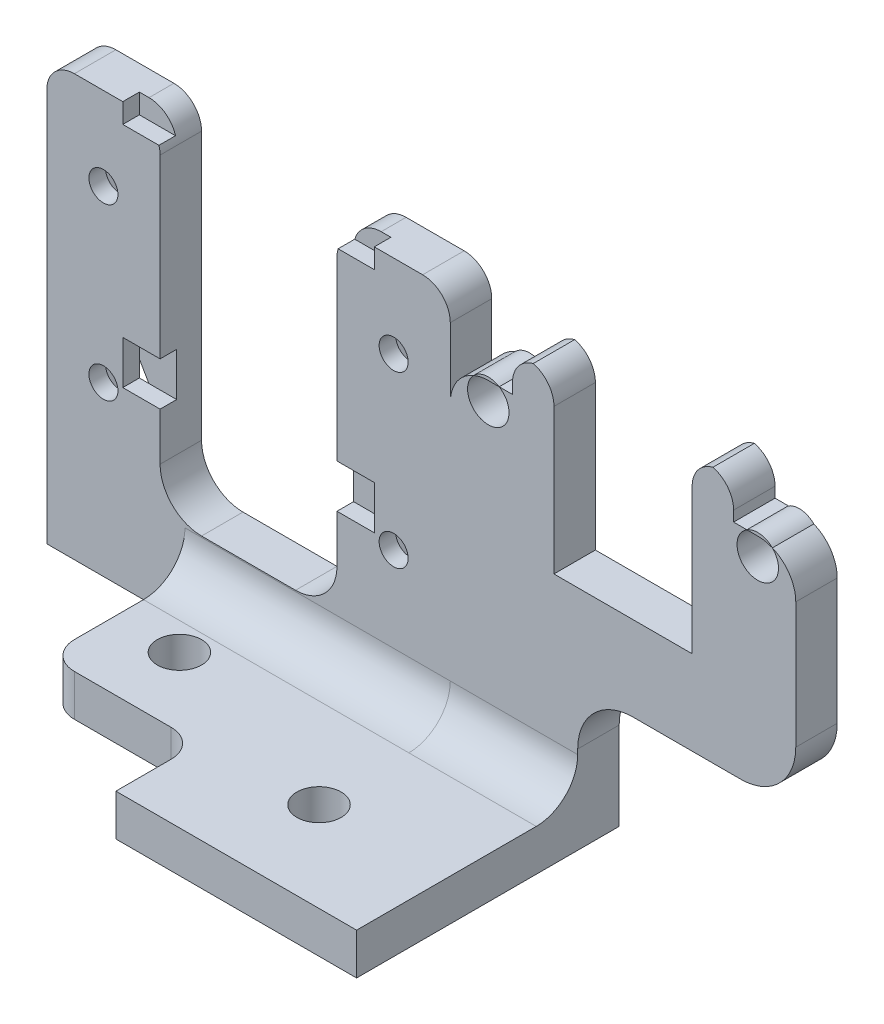
from build123d import *

# Parameters (mm, degrees)
ESBO_O2_W                  = 8.2
ESBO_O2_H                  = 30.460387467
RESSALTO_EXTRUS_O1_DEPTH   = 3
RESSALTO_EXTRUS_O1_2_DEPTH = 3
RESSALTO_EXTRUS_O2_REACH   = 32.935
ESBO_O3_W                  = 3
ESBO_O3_H                  = 6.088150409
ESBO_O4_W                  = 12.8
ESBO_O4_H                  = 3
RESSALTO_EXTRUS_O3_DEPTH   = 10
ESBO_O5_W                  = 8.2
ESBO_O5_H                  = 3
RESSALTO_EXTRUS_O4_DEPTH   = 16
ESBO_O8_R                  = 1.05
CORTE_EXTRUS_O3_DEPTH      = 32.131124741
FILETE1_R                  = 3
ESBO_O9_W                  = 1.2
ESBO_O9_H                  = 3.148787123
CORTE_EXTRUS_O4_DEPTH      = 2.7
FILETE2_R                  = 3
CORTE_EXTRUS_O5_DEPTH      = 1.8
ESBO_O13_W                 = 2.7
ESBO_O13_H                 = 3.148787123
CORTE_EXTRUS_O7_DEPTH      = 1.2
ESBO_O14_W                 = 19
ESBO_O14_H                 = 3
RESSALTO_EXTRUS_O5_DEPTH   = 25
ESBO_O15_W                 = 25
ESBO_O15_H                 = 3
RESSALTO_EXTRUS_O6_DEPTH   = 25.96
ESBO_O16_W                 = 10
ESBO_O16_H                 = 12.5
ESBO_O16_W_2               = 15.78
ESBO_O16_H_2               = 7.353285402
CORTE_EXTRUS_O8_DEPTH      = 26
FILETE4_R                  = 4
FILETE5_R                  = 2
CORTE_EXTRUS_O10_DEPTH     = 10
ESBO_O19_W                 = 19
ESBO_O19_H                 = 5
CORTE_EXTRUS_O13_DEPTH     = 15.78
FILETE7_R                  = 4
FILETE8_R                  = 3
ESBO_O20_R                 = 1.6
CORTE_EXTRUS_O14_DEPTH     = 12
FILETE9_R                  = 2


with BuildPart() as part:
    # Esboço2 → Ressalto-extrusão1 (new body)
    with BuildSketch(Plane(origin=(0, 0, -1), x_dir=(-1, 0, 0), z_dir=(0, 0, -1))):
        with Locations((10.5, -7.130193734)):
            Rectangle(ESBO_O2_W, ESBO_O2_H)
    extrude(amount=RESSALTO_EXTRUS_O1_DEPTH)


with BuildPart() as body_2:
    # Esboço2 → Ressalto-extrus_o1 2 (new body)
    with BuildSketch(Plane(origin=(0, 0, -1), x_dir=(-1, 0, 0), z_dir=(0, 0, -1))):
        with Locations((-10.5, -7.130193734)):
            Rectangle(ESBO_O2_W, ESBO_O2_H)
    extrude(amount=RESSALTO_EXTRUS_O1_2_DEPTH)

    # Esboço3 → Ressalto-extrusão2 (add, up to next)
    with BuildSketch(Plane(origin=(-6.4, 0, 0), x_dir=(0, 0, -1), z_dir=(1, 0, 0)), mode=Mode.PRIVATE) as ressalto_extrus_o2_sk1:
        with Locations((2.5, -19.316312263)):
            Rectangle(ESBO_O3_W, ESBO_O3_H)
    ressalto_extrus_o2_tool1 = extrude(ressalto_extrus_o2_sk1.sketch, amount=RESSALTO_EXTRUS_O2_REACH, mode=Mode.PRIVATE) - body_2.part

    add(part.part)  # Ressalto-extrusão2 merges part
    add(ressalto_extrus_o2_tool1.solids().sort_by_distance((-6.4, -19.316312, -2.5))[0])

    # Esboço4 → Ressalto-extrusão3 (add)
    with BuildSketch(Plane.XY.offset(-1)):
        with Locations((0, -20.860387467)):
            Rectangle(ESBO_O4_W, ESBO_O4_H)
    extrude(amount=RESSALTO_EXTRUS_O3_DEPTH)

    # Esboço5 → Ressalto-extrusão4 (add)
    with BuildSketch(Plane.XY.offset(-1)):
        with Locations((-10.5, -20.860387467)):
            Rectangle(ESBO_O5_W, ESBO_O5_H)
        with Locations((10.5, -20.860387467)):
            Rectangle(ESBO_O5_W, ESBO_O5_H)
    extrude(amount=RESSALTO_EXTRUS_O4_DEPTH)

    # Esboço8 → Corte-extrusão3 (cut, through all)
    with BuildSketch(Plane.XY.offset(-1)):
        with Locations((-10.5, 2.1)):
            Circle(ESBO_O8_R)
        with Locations((10.5, 2.1)):
            Circle(ESBO_O8_R)
        with Locations((10.5, -10.2)):
            Circle(ESBO_O8_R)
        with Locations((-10.5, -10.2)):
            Circle(ESBO_O8_R)
    extrude(amount=-CORTE_EXTRUS_O3_DEPTH, mode=Mode.SUBTRACT)

    # Filete1
    filete1_edges = [body_2.edges().sort_by_distance(p)[0] for p in [
        (6.4, -16.272237058, -2.5),
        (-6.4, -16.272237058, -2.5),
    ]]
    fillet(filete1_edges, radius=FILETE1_R)

    # Esboço9 → Corte-extrusão4 (cut)
    with BuildSketch(Plane.ZY.offset(-6.4)):
        with Locations((-1.6, -8.245598841)):
            Rectangle(ESBO_O9_W, ESBO_O9_H)
    extrude(amount=-CORTE_EXTRUS_O4_DEPTH, mode=Mode.SUBTRACT)

    # Filete2
    filete2_edges = [body_2.edges().sort_by_distance(p)[0] for p in [
        (0, -19.360387467, -1),
    ]]
    fillet(filete2_edges, radius=FILETE2_R)

    # Esboço10 → Corte-extrusão5 (cut)
    with BuildSketch(Plane(origin=(0, 0, -4), x_dir=(-1, 0, 0), z_dir=(0, 0, -1))):
        Polygon((12.809401077, 2.1), (11.654700538, 4.1), (9.345299462, 4.1), (8.190598923, 2.1), (9.345299462, 0.1), (11.654700538, 0.1), align=None)
        Polygon((12.809401077, -10.2), (11.654700538, -8.2), (9.345299462, -8.2), (8.190598923, -10.2), (9.345299462, -12.2), (11.654700538, -12.2), align=None)
        Polygon((-11.654700538, -12.2), (-12.809401077, -10.2), (-11.654700538, -8.2), (-9.345299462, -8.2), (-8.190598923, -10.2), (-9.345299462, -12.2), align=None)
        Polygon((-11.654700538, 0.1), (-12.809401077, 2.1), (-11.654700538, 4.1), (-9.345299462, 4.1), (-8.190598923, 2.1), (-9.345299462, 0.1), align=None)
    extrude(amount=-CORTE_EXTRUS_O5_DEPTH, mode=Mode.SUBTRACT)

    # Esboço13 → Corte-extrusão7 (cut)
    with BuildSketch(Plane.XY.offset(-1)):
        with Locations((7.75, -8.245598841)):
            Rectangle(ESBO_O13_W, ESBO_O13_H)
        with Locations((7.75, 8.245598841)):
            Rectangle(ESBO_O13_W, ESBO_O13_H)
        with Locations((-7.75, 8.245598841)):
            Rectangle(ESBO_O13_W, ESBO_O13_H)
        with Locations((-7.75, -8.245598841)):
            Rectangle(ESBO_O13_W, ESBO_O13_H)
    extrude(amount=-CORTE_EXTRUS_O7_DEPTH, mode=Mode.SUBTRACT)

    # Esboço14 → Ressalto-extrusão5 (add)
    with BuildSketch(Plane(origin=(14.6, 0, 0), x_dir=(0, 0, -1), z_dir=(1, 0, 0))):
        with Locations((-5.5, -20.860387467)):
            Rectangle(ESBO_O14_W, ESBO_O14_H)
    extrude(amount=RESSALTO_EXTRUS_O5_DEPTH)

    # Esboço15 → Ressalto-extrusão6 (add)
    with BuildSketch(Plane(origin=(0, -19.360387467, 0), x_dir=(1, 0, 0), z_dir=(0, 1, 0))):
        with Locations((27.1, 2.5)):
            Rectangle(ESBO_O15_W, ESBO_O15_H)
    extrude(amount=RESSALTO_EXTRUS_O6_DEPTH)

    # Esboço16 → Corte-extrusão8 (cut)
    with BuildSketch(Plane(origin=(0, 0, -4), x_dir=(-1, 0, 0), z_dir=(0, 0, -1))):
        with BuildLine():
            Line((-36.06071018, 3.849612533), (-35.1, 3.849612533))
            Line((-35.1, 3.849612533), (-35.1, 6.599612533))
            Line((-35.1, 6.599612533), (-39.6, 6.599612533))
            Line((-39.6, 6.599612533), (-39.6, 1.099612533))
            ThreePointArc((-39.6, 1.099612533), (-39.137935656, 2.625342009), (-37.907017867, 3.638354983))
            ThreePointArc((-37.907017867, 3.638354983), (-37.020519838, 4.064341116), (-36.06071018, 3.849612533))
        make_face()
        with BuildLine():
            ThreePointArc((-37.907017867, 3.638354983), (-36.679480162, 1.083788828), (-36.06071018, 3.849612533))
            Line((-36.06071018, 3.849612533), (-36.85, 3.849612533))
            ThreePointArc((-36.85, 3.849612533), (-37.388961159, 3.796281009), (-37.907017867, 3.638354983))
        make_face()
        with Locations((-27.1, 0.349612533)):
            Rectangle(ESBO_O16_W, ESBO_O16_H)
        with Locations((-31.71, -15.683744766)):
            Rectangle(ESBO_O16_W_2, ESBO_O16_H_2)
        with BuildLine():
            Line((-14.6, 6.599612533), (-19.1, 6.599612533))
            Line((-19.1, 6.599612533), (-19.1, 3.849612533))
            Line((-19.1, 3.849612533), (-18.13928982, 3.849612533))
            ThreePointArc((-18.13928982, 3.849612533), (-17.179480162, 4.064341116), (-16.292982133, 3.638354983))
            ThreePointArc((-16.292982133, 3.638354983), (-15.062064344, 2.625342009), (-14.6, 1.099612533))
            Line((-14.6, 1.099612533), (-14.6, 6.599612533))
        make_face()
        with BuildLine():
            Line((-17.35, 3.849612533), (-18.13928982, 3.849612533))
            ThreePointArc((-18.13928982, 3.849612533), (-17.520519838, 1.083788828), (-16.292982133, 3.638354983))
            ThreePointArc((-16.292982133, 3.638354983), (-16.811038841, 3.796281009), (-17.35, 3.849612533))
        make_face()
    extrude(amount=-CORTE_EXTRUS_O8_DEPTH, mode=Mode.SUBTRACT)


with BuildPart() as corte_extrus_o8_piece_1:
    # of the separate pieces the step leaves, piece 1, a body of its own (corte_extrus_o8_pieces)
    add(body_2.part.solids().sort_by_distance((14.6, -19.360387467, -1))[0])

    # Filete4
    filete4_edges = [corte_extrus_o8_piece_1.edges().sort_by_distance(p)[0] for p in [
        (39.6, -12.007102065, -2.5),
    ]]
    fillet(filete4_edges, radius=FILETE4_R)

    # Filete5
    # the kernel refuses this fillet: 2 mm, written as the material it takes off along each edge
    with BuildSketch(Plane(origin=(32.1, 6.599612533, -9), x_dir=(1, 0, 0), z_dir=(0, 0, 1)), Plane(origin=(19.1, 6.599612533, -9), x_dir=(1, 0, 0), z_dir=(0, 0, 1)), Plane(origin=(35.1, 6.599612533, -9), x_dir=(0, -1, 0), z_dir=(0, 0, 1)), Plane(origin=(22.1, 6.599612533, -9), x_dir=(0, -1, 0), z_dir=(0, 0, 1)), Plane(origin=(14.6, 8.1, 4), x_dir=(-1, 0, 0), z_dir=(0, 0, -1)), Plane(origin=(-14.6, 8.1, 4), x_dir=(0, -1, 0), z_dir=(0, 0, -1))) as filete5_piece_1:
        with BuildLine():
            CenterArc((FILETE5_R, -FILETE5_R), FILETE5_R, 90, 90)
            Line((0, -FILETE5_R), (0, 0))
            Line((0, 0), (FILETE5_R, 0))
        make_face()
    extrude(amount=13, mode=Mode.SUBTRACT)
    with BuildSketch(Plane(origin=(-6.4, 8.1, 2.8), x_dir=(-1, 0, 0), z_dir=(0, 0, -1)), Plane(origin=(6.4, 8.1, 2.8), x_dir=(0, -1, 0), z_dir=(0, 0, -1))) as filete5_piece_2:
        with BuildLine():
            CenterArc((FILETE5_R, -FILETE5_R), FILETE5_R, 90, 90)
            Line((0, -FILETE5_R), (0, 0))
            Line((0, 0), (FILETE5_R, 0))
        make_face()
    extrude(amount=11.8, mode=Mode.SUBTRACT)

    # Esboço18 → Corte-extrusão10 (cut)
    with BuildSketch(Plane.ZY.offset(14.6)):
        Polygon((-1, -16.360387467), (-1, -22.360387467), (15, -22.360387467), (15, -19.360387467), align=None)
    extrude(amount=-CORTE_EXTRUS_O10_DEPTH, mode=Mode.SUBTRACT)

    # Esboço19 → Corte-extrusão13 (cut)
    with BuildSketch(Plane(origin=(39.6, 0, 0), x_dir=(0, 0, -1), z_dir=(1, 0, 0))):
        with Locations((-5.5, -19.860387467)):
            Rectangle(ESBO_O19_W, ESBO_O19_H)
    extrude(amount=-CORTE_EXTRUS_O13_DEPTH, mode=Mode.SUBTRACT)

    # Filete7
    filete7_edges = [corte_extrus_o8_piece_1.edges().sort_by_distance(p)[0] for p in [
        (23.82, -12.007102065, -2.5),
    ]]
    fillet(filete7_edges, radius=FILETE7_R)

    # Filete8
    filete8_edges = [corte_extrus_o8_piece_1.edges().sort_by_distance(p)[0] for p in [
        (19.21, -19.360387467, -1),
    ]]
    fillet(filete8_edges, radius=FILETE8_R)

    # Esboço20 → Corte-extrusão14 (cut)
    with BuildSketch(Plane(origin=(0, -19.360387467, 0), x_dir=(1, 0, 0), z_dir=(0, 1, 0))):
        with Locations(Location((14.6, -8.5, 0), (0, 0, 270))):
            Circle(ESBO_O20_R)
        with Locations(Location((0, -4, 0), (0, 0, 270))):
            Circle(ESBO_O20_R)
    extrude(amount=-CORTE_EXTRUS_O14_DEPTH, mode=Mode.SUBTRACT)

    # Filete9
    filete9_edges = [corte_extrus_o8_piece_1.edges().sort_by_distance(p)[0] for p in [
        (6.4, -20.860387467, 9),
        (-4.6, -20.860387467, 9),
    ]]
    fillet(filete9_edges, radius=FILETE9_R)


with BuildPart() as corte_extrus_o8_piece_2:
    # of the separate pieces the step leaves, piece 2, a body of its own (corte_extrus_o8_pieces)
    add(body_2.part.solids().sort_by_distance((17.35, 3.849612533, -1))[0])


with BuildPart() as corte_extrus_o8_piece_3:
    # of the separate pieces the step leaves, piece 3, a body of its own (corte_extrus_o8_pieces)
    add(body_2.part.solids().sort_by_distance((36.85, 3.849612533, -1))[0])


solid = Compound([corte_extrus_o8_piece_1.part, corte_extrus_o8_piece_2.part, corte_extrus_o8_piece_3.part])
